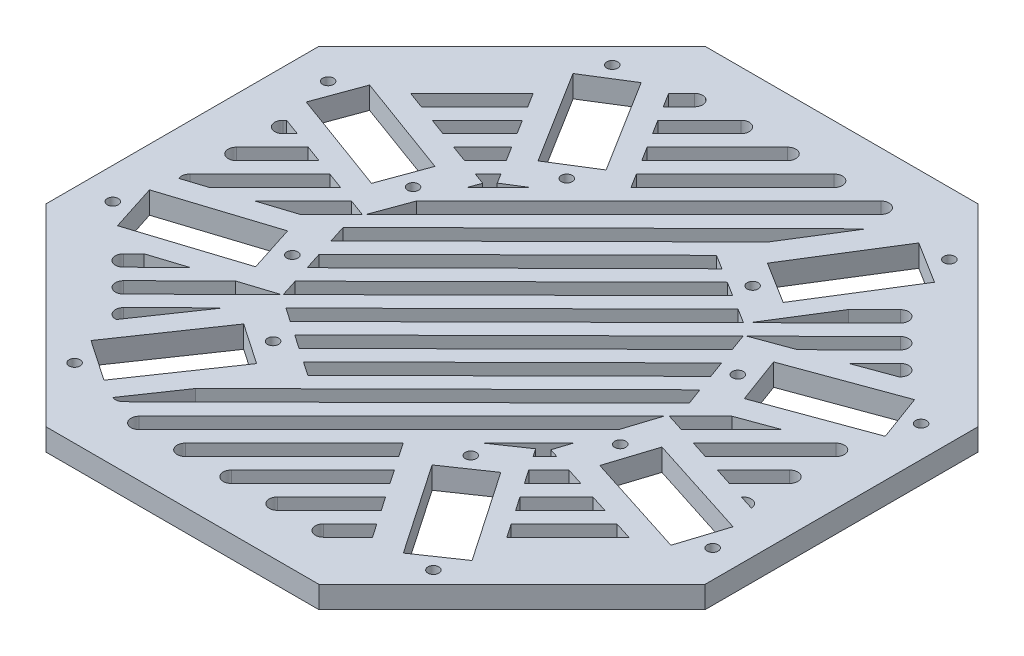
from build123d import *

# Parameters (mm, degrees)
SKETCH_R            = 1
BOSS_EXTRUDE1_DEPTH = 4
BOSS_EXTRUDE2_DEPTH = 4


with BuildPart() as part:
    # Sketch → Boss-Extrude1 (new body)
    with BuildSketch(Plane(origin=(0, 0, 0), x_dir=(1, 0, 0), z_dir=(0, 1, 0))):
        Polygon((24.852813742, -60), (60, -24.852813742), (60, 24.852813742), (24.852813742, 60), (-24.852813742, 60), (-60, 24.852813742), (-60, -24.852813742), (-24.852813742, -60), align=None)
        with BuildLine():
            ThreePointArc((15.547632792, 51.610078632), (17.668953135, 51.610078632), (17.668953135, 49.488758289))
            Line((17.668953135, 49.488758289), (-29.181889622, 2.637915532))
            Line((-29.181889622, 2.637915532), (-26.726613217, 9.335832623))
            Line((-26.726613217, 9.335832623), (15.547632792, 51.610078632))
        make_face(mode=Mode.SUBTRACT)
        Polygon((-18.457469949, 21.847616579), (-24.271336813, 16.033749714), (-23.491472568, 18.161194936), (-25.60995394, 18.937773275), (-23.289921125, 21.25780609), (-22.199833785, 19.511517433), align=None, mode=Mode.SUBTRACT)
        with BuildLine():
            Line((9.183671761, 49.488758289), (-9.321050806, 30.984035722))
            Line((-9.321050806, 30.984035722), (-10.951599402, 33.596127812))
            Line((-10.951599402, 33.596127812), (7.062351417, 51.610078632))
            ThreePointArc((7.062351417, 51.610078632), (9.183671761, 51.610078632), (9.183671761, 49.488758289))
        make_face(mode=Mode.SUBTRACT)
        with BuildLine():
            Line((0.698390387, 49.488758289), (-12.582147999, 36.208219903))
            Line((-12.582147999, 36.208219903), (-14.212696595, 38.820311994))
            Line((-14.212696595, 38.820311994), (-1.422929957, 51.610078632))
            ThreePointArc((-1.422929957, 51.610078632), (0.698390387, 51.610078632), (0.698390387, 49.488758289))
        make_face(mode=Mode.SUBTRACT)
        with BuildLine():
            Line((-7.786890987, 49.488758289), (-15.843245192, 41.432404084))
            Line((-15.843245192, 41.432404084), (-17.473793788, 44.044496175))
            Line((-17.473793788, 44.044496175), (-9.908211331, 51.610078632))
            ThreePointArc((-9.908211331, 51.610078632), (-7.786890987, 51.610078632), (-7.786890987, 49.488758289))
        make_face(mode=Mode.SUBTRACT)
        with BuildLine():
            Line((-16.272172362, 49.488758289), (-19.104342385, 46.656588265))
            Line((-19.104342385, 46.656588265), (-20.734890981, 49.268680356))
            Line((-20.734890981, 49.268680356), (-18.393492705, 51.610078632))
            ThreePointArc((-18.393492705, 51.610078632), (-16.272172362, 51.610078632), (-16.272172362, 49.488758289))
        make_face(mode=Mode.SUBTRACT)
        with BuildLine():
            Line((-23.386884958, -49.297198938), (-17.265542524, -40.337796786))
            Line((-17.265542524, -40.337796786), (28.858580089, 5.368255674))
            Line((28.858580089, 5.368255674), (29.994252328, 2.270177395))
            Line((29.994252328, 2.270177395), (-21.732188811, -48.987414041))
            ThreePointArc((-21.732188811, -48.987414041), (-22.511981545, -49.396320284), (-23.386884958, -49.297198938))
        make_face(mode=Mode.SUBTRACT)
        with BuildLine():
            ThreePointArc((-15.920221348, -51.966319523), (-18.035989196, -51.966319523), (-18.035989196, -49.850551674))
            Line((-18.035989196, -49.850551674), (29.735518609, -2.079043869))
            Line((29.735518609, -2.079043869), (27.74095069, -8.305147485))
            Line((27.74095069, -8.305147485), (-15.920221348, -51.966319523))
        make_face(mode=Mode.SUBTRACT)
        with BuildLine():
            ThreePointArc((17.847543234, -52.154981783), (15.72622289, -52.154981783), (15.72622289, -50.033661439))
            Line((15.72622289, -50.033661439), (20.576321038, -45.183563292))
            Line((20.576321038, -45.183563292), (23.313158292, -49.189290117))
            Line((23.313158292, -49.189290117), (19.196886167, -50.80563885))
            Line((19.196886167, -50.80563885), (17.847543234, -52.154981783))
        make_face(mode=Mode.SUBTRACT)
        with Locations((-29.233693124, 11.213036685)):
            Circle(SKETCH_R, mode=Mode.SUBTRACT)
        with Locations((-16.577946016, 26.557394094)):
            Circle(SKETCH_R, mode=Mode.SUBTRACT)
        Polygon((-21.98384641, 26.719384625), (-32.574440455, 43.685212567), (-24.939817881, 48.450979888), (-14.349223836, 31.485151945), align=None, mode=Mode.SUBTRACT)
        Polygon((-29.237090611, -1.51987861), (18.657229481, 45.940326216), (11.745261483, 34.867551704), (-28.210101751, -4.725655158), align=None, mode=Mode.SUBTRACT)
        Polygon((-29.545551543, 2.274253611), (-35.204493859, -3.384688706), (-41.44693689, -5.38449105), (-32.650135269, 3.412310571), align=None, mode=Mode.SUBTRACT)
        with Locations((-30.345718275, 48.612970419)):
            Circle(SKETCH_R, mode=Mode.SUBTRACT)
        Polygon((-44.237456298, 25.766115039), (-33.073212704, 36.930358634), (-31.442664107, 34.318266543), (-41.132872572, 24.628058079), align=None, mode=Mode.SUBTRACT)
        Polygon((-49.279703668, 23.354184129), (-30.501609685, 16.470639522), (-33.599204758, 8.02049723), (-52.377298741, 14.904041837), align=None, mode=Mode.SUBTRACT)
        with Locations((-53.645215302, 20.161644674)):
            Circle(SKETCH_R, mode=Mode.SUBTRACT)
        with BuildLine():
            Line((-51.610078632, -7.062351417), (-38.859302722, 5.688424493))
            Line((-38.859302722, 5.688424493), (-35.754718996, 4.550367532))
            Line((-35.754718996, 4.550367532), (-47.689379922, -7.384293394))
            Line((-47.689379922, -7.384293394), (-51.917232508, -8.738710162))
            ThreePointArc((-51.917232508, -8.738710162), (-52.024856164, -7.852671836), (-51.610078632, -7.062351417))
        make_face(mode=Mode.SUBTRACT)
        with BuildLine():
            ThreePointArc((-49.488758289, -0.698390387), (-51.610078632, -0.698390387), (-51.610078632, 1.422929957))
            Line((-51.610078632, 1.422929957), (-45.068470175, 7.964538414))
            Line((-45.068470175, 7.964538414), (-41.963886448, 6.826481454))
            Line((-41.963886448, 6.826481454), (-49.488758289, -0.698390387))
        make_face(mode=Mode.SUBTRACT)
        with BuildLine():
            Line((-51.610078632, 9.908211331), (-51.277637627, 10.240652336))
            Line((-51.277637627, 10.240652336), (-48.173053901, 9.102595375))
            Line((-48.173053901, 9.102595375), (-49.488758289, 7.786890987))
            ThreePointArc((-49.488758289, 7.786890987), (-51.610078632, 7.786890987), (-51.610078632, 9.908211331))
        make_face(mode=Mode.SUBTRACT)
        Polygon((-52.790849345, -13.218821714), (-33.744334088, -7.117161568), (-30.998587022, -15.688093434), (-50.045102279, -21.78975358), align=None, mode=Mode.SUBTRACT)
        with Locations((-54.274953101, -18.419536669)):
            Circle(SKETCH_R, mode=Mode.SUBTRACT)
        with BuildLine():
            Line((-40.814392402, -29.885895415), (-30.594871143, -19.759004142))
            Line((-30.594871143, -19.759004142), (-24.296658913, -17.741335815))
            Line((-24.296658913, -17.741335815), (-38.70275156, -32.016851293))
            ThreePointArc((-38.70275156, -32.016851293), (-40.82404992, -32.007193775), (-40.814392402, -29.885895415))
        make_face(mode=Mode.SUBTRACT)
        Polygon((16.999603088, 23.180615877), (-24.10218888, -17.548628463), (-25.12917774, -14.342851915), (14.384729777, 24.812900598), align=None, mode=Mode.SUBTRACT)
        Polygon((-21.739006454, -19.4302352), (19.614422203, 21.548364988), (22.229295514, 19.916080268), (-19.216285307, -21.153836814), align=None, mode=Mode.SUBTRACT)
        with BuildLine():
            Line((-36.571751715, -34.128536102), (-27.407885848, -25.047731735))
            Line((-27.407885848, -25.047731735), (-35.359392435, -36.685823541))
            ThreePointArc((-35.359392435, -36.685823541), (-36.871330347, -35.836581863), (-36.571751715, -34.128536102))
        make_face(mode=Mode.SUBTRACT)
        with BuildLine():
            Line((-45.057033089, -25.643254728), (-43.191165064, -23.794298975))
            Line((-43.191165064, -23.794298975), (-36.892952834, -21.776630649))
            Line((-36.892952834, -21.776630649), (-42.945392247, -27.774210606))
            ThreePointArc((-42.945392247, -27.774210606), (-45.066690607, -27.764553088), (-45.057033089, -25.643254728))
        make_face(mode=Mode.SUBTRACT)
        Polygon((-34.351904297, -42.301756928), (-23.069244775, -25.788077928), (-15.638089225, -30.865274713), (-26.920748747, -47.378953713), align=None, mode=Mode.SUBTRACT)
        with Locations((-32.32872545, -47.31740717)):
            Circle(SKETCH_R, mode=Mode.SUBTRACT)
        Polygon((30.237983833, -1.576578645), (35.933840849, 4.119278371), (42.614226335, 6.56812816), (33.442829032, -2.603269143), align=None, mode=Mode.SUBTRACT)
        Polygon((17.547499239, -22.756933339), (25.733750988, -14.570681589), (24.741860203, -17.666898441), (26.361359089, -18.185714176), (24.197771941, -20.349301324), (23.202813421, -18.893046654), align=None, mode=Mode.SUBTRACT)
        with BuildLine():
            Line((-9.589856533, -49.894289111), (10.243838043, -30.060594535))
            Line((10.243838043, -30.060594535), (11.965945086, -32.581128179))
            Line((11.965945086, -32.581128179), (-7.46853619, -52.015609454))
            ThreePointArc((-7.46853619, -52.015609454), (-9.589856533, -52.015609454), (-9.589856533, -49.894289111))
        make_face(mode=Mode.SUBTRACT)
        with BuildLine():
            Line((-1.151163392, -49.940746554), (13.687999041, -35.101584121))
            Line((13.687999041, -35.101584121), (15.410106084, -37.622117764))
            Line((15.410106084, -37.622117764), (0.970156952, -52.062066897))
            ThreePointArc((0.970156952, -52.062066897), (-1.151163392, -52.062066897), (-1.151163392, -49.940746554))
        make_face(mode=Mode.SUBTRACT)
        with BuildLine():
            Line((7.287529749, -49.987203996), (17.132160039, -40.142573707))
            Line((17.132160039, -40.142573707), (18.854267083, -42.66310735))
            Line((18.854267083, -42.66310735), (9.408850093, -52.10852434))
            ThreePointArc((9.408850093, -52.10852434), (7.287529749, -52.10852434), (7.287529749, -49.987203996))
        make_face(mode=Mode.SUBTRACT)
        with Locations((33.006285238, -47.31740717)):
            Circle(SKETCH_R, mode=Mode.SUBTRACT)
        Polygon((27.598308535, -47.378953713), (16.315649013, -30.865274713), (23.746804563, -25.788077928), (35.029464085, -42.301756928), align=None, mode=Mode.SUBTRACT)
        with Locations((31.023278063, 48.612970419)):
            Circle(SKETCH_R, mode=Mode.SUBTRACT)
        Polygon((33.252000243, 43.685212567), (22.661406198, 26.719384625), (15.026783624, 31.485151945), (25.617377669, 48.450979888), align=None, mode=Mode.SUBTRACT)
        Polygon((-24.920469721, 23.869898181), (-28.714537666, 20.075830236), (-31.819121393, 21.213887196), (-26.551018318, 26.481990271), align=None, mode=Mode.SUBTRACT)
        Polygon((34.276764546, 8.02049723), (31.179169473, 16.470639522), (49.957263456, 23.354184129), (53.054858529, 14.904041837), align=None, mode=Mode.SUBTRACT)
        with Locations((30.192043054, -10.487378479)):
            Circle(SKETCH_R, mode=Mode.SUBTRACT)
        with Locations((18.33882786, -25.849624471)):
            Circle(SKETCH_R, mode=Mode.SUBTRACT)
        Polygon((-26.156145315, -11.137141811), (-27.183134176, -7.931365263), (9.155037352, 28.077436207), (11.769910663, 26.445151487), align=None, mode=Mode.SUBTRACT)
        with Locations((-29.514483266, -10.487378479)):
            Circle(SKETCH_R, mode=Mode.SUBTRACT)
        with BuildLine():
            Line((36.571751715, 34.128536102), (22.814148734, 20.495632364))
            Line((22.814148734, 20.495632364), (29.726116733, 31.568406876))
            Line((29.726116733, 31.568406876), (34.460110873, 36.25949198))
            ThreePointArc((34.460110873, 36.25949198), (36.581409233, 36.249834462), (36.571751715, 34.128536102))
        make_face(mode=Mode.SUBTRACT)
        with BuildLine():
            Line((45.057033089, 25.643254728), (44.939384704, 25.52667271))
            Line((44.939384704, 25.52667271), (38.174957969, 23.047015658))
            Line((38.174957969, 23.047015658), (42.945392247, 27.774210606))
            ThreePointArc((42.945392247, 27.774210606), (45.066690607, 27.764553088), (45.057033089, 25.643254728))
        make_face(mode=Mode.SUBTRACT)
        with BuildLine():
            Line((40.814392402, 29.885895415), (31.410671434, 20.56741))
            Line((31.410671434, 20.56741), (24.646244699, 18.087752947))
            Line((24.646244699, 18.087752947), (38.70275156, 32.016851293))
            ThreePointArc((38.70275156, 32.016851293), (40.82404992, 32.007193775), (40.814392402, 29.885895415))
        make_face(mode=Mode.SUBTRACT)
        Polygon((-16.693616445, -22.877402704), (24.315938212, 17.760440366), (25.45161045, 14.662362087), (-14.170895298, -24.601004319), align=None, mode=Mode.SUBTRACT)
        with Locations((17.255505804, 26.557394094)):
            Circle(SKETCH_R, mode=Mode.SUBTRACT)
        with Locations((-17.661268072, -25.849624471)):
            Circle(SKETCH_R, mode=Mode.SUBTRACT)
        Polygon((27.722931389, 8.466269741), (-9.125505289, -28.048171823), (-11.648226436, -26.324570209), (26.587259151, 11.56434802), align=None, mode=Mode.SUBTRACT)
        with BuildLine():
            Line((39.881226615, -4.665846649), (36.667970811, -3.636461766))
            Line((36.667970811, -3.636461766), (49.662001896, 9.357569318))
            ThreePointArc((49.662001896, 9.357569318), (51.783322239, 9.357569318), (51.783322239, 7.236248975))
            Line((51.783322239, 7.236248975), (39.881226615, -4.665846649))
        make_face(mode=Mode.SUBTRACT)
        Polygon((34.421893876, -7.117161568), (53.468409133, -13.218821714), (50.722662067, -21.78975358), (31.67614681, -15.688093434), align=None, mode=Mode.SUBTRACT)
        Polygon((25.919825896, -22.869757266), (29.574515836, -19.215067325), (32.78777164, -20.244452208), (27.641932939, -25.39029091), align=None, mode=Mode.SUBTRACT)
        with Locations((54.32277509, 20.161644674)):
            Circle(SKETCH_R, mode=Mode.SUBTRACT)
        Polygon((45.640596743, -24.361928274), (34.530254936, -35.472270081), (32.808147893, -32.951736437), (42.427340939, -23.332543391), align=None, mode=Mode.SUBTRACT)
        with Locations((54.952512889, -18.419536669)):
            Circle(SKETCH_R, mode=Mode.SUBTRACT)
        with BuildLine():
            ThreePointArc((49.662001896, -7.61273185), (51.271547699, -7.277424772), (52.221682179, -8.619182201))
            Line((52.221682179, -8.619182201), (49.520795914, -7.753937832))
            Line((49.520795914, -7.753937832), (49.662001896, -7.61273185))
        make_face(mode=Mode.SUBTRACT)
        with BuildLine():
            Line((51.783322239, -1.248901609), (46.307639167, -6.724584682))
            Line((46.307639167, -6.724584682), (43.094383363, -5.695199799))
            Line((43.094383363, -5.695199799), (49.662001896, 0.872418734))
            ThreePointArc((49.662001896, 0.872418734), (51.783322239, 0.872418734), (51.783322239, -1.248901609))
        make_face(mode=Mode.SUBTRACT)
        Polygon((-29.812115511, 31.706174452), (-28.181566914, 29.094082362), (-34.923705119, 22.351944157), (-38.028288845, 23.490001118), align=None, mode=Mode.SUBTRACT)
        with Locations((29.911252912, 11.213036685)):
            Circle(SKETCH_R, mode=Mode.SUBTRACT)
        Polygon((31.086093937, -30.431280495), (29.363986894, -27.910746852), (36.000928388, -21.273805358), (39.214184192, -22.303190241), align=None, mode=Mode.SUBTRACT)
    extrude(amount=BOSS_EXTRUDE1_DEPTH)

    # Sketch<10> → Boss-Extrude2 (add)
    with BuildSketch(Plane(origin=(0, 0, 0), x_dir=(1, 0, 0), z_dir=(0, 1, 0))):
        Polygon((19.196886167, -50.80563885), (23.313158292, -49.189290117), (22.298428081, -47.704096936), align=None)
    extrude(amount=BOSS_EXTRUDE2_DEPTH)


solid = part.part
